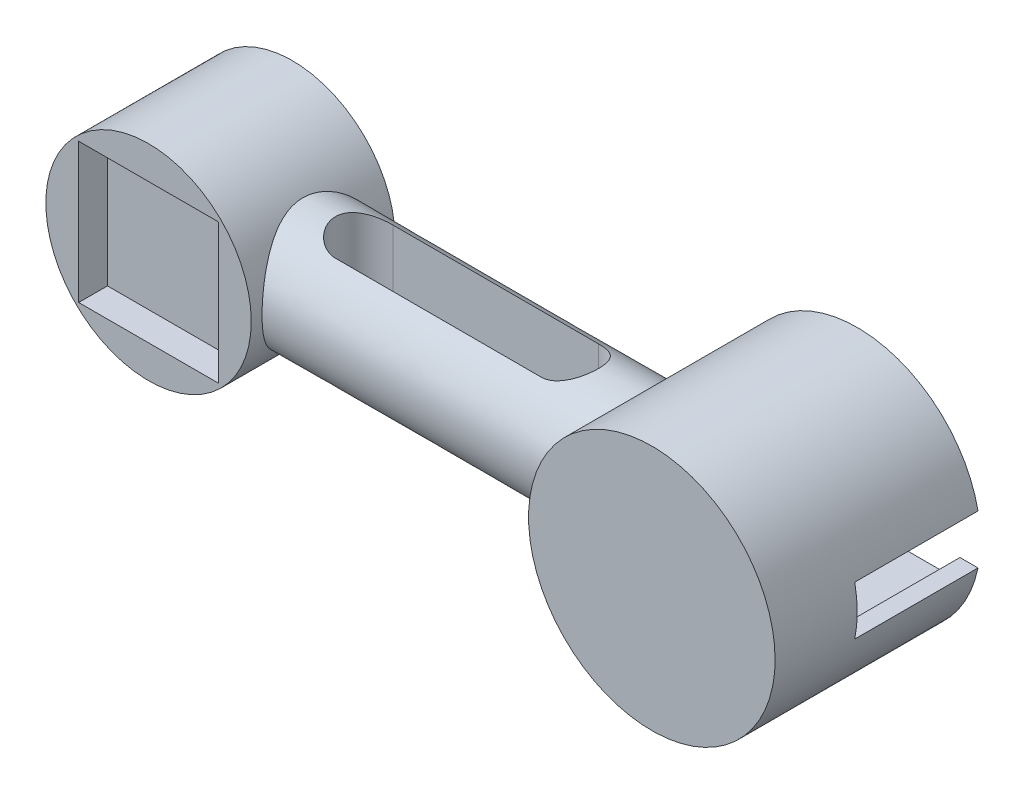
from build123d import *

# Parameters (mm, degrees)
SKETCH1_R               = 25
BOSS_EXTRUDE1_DEPTH     = 17.5
SKETCH4_R               = 30
BOSS_EXTRUDE2_DEPTH     = 25
CUT_EXTRUDE1_DEPTH      = 165.696691051
CUT_EXTRUDE1_DEPTH_BACK = 165.696691051
SKETCH6_W               = 34
SKETCH6_H               = 34
CUT_EXTRUDE2_DEPTH      = 7
SKETCH7_R               = 3.9
BOSS_EXTRUDE3_DEPTH     = 7
BOSS_EXTRUDE3_TAPER     = 2
CUT_EXTRUDE3_START      = -30
SKETCH8_W               = 42
SKETCH8_H               = 22
CUT_EXTRUDE3_DEPTH      = 30


with BuildPart() as part:
    # Sketch1 → Boss-Extrude1 (new, symmetric)
    with BuildSketch(Plane.XY):
        Circle(SKETCH1_R)
    extrude(amount=BOSS_EXTRUDE1_DEPTH, both=True)

    # Loft1: read off the stored shape, not the designer's step
    # Loft1: loft between two sections, ruled curve by curve
    loft1_from = [
        Edge.make_bspline([(0, 9.43003665, -11.665093603), (0, 32.760223857, 7.194979697), (0, 13.900150557, 30.525166904), (0, -9.43003665, 11.665093603), (0, -32.760223857, -7.194979697), (0, -13.900150557, -30.525166904), (0, 9.43003665, -11.665093603)], [0, 0, 0, 0, 0.5, 0.5, 0.5, 1, 1, 1, 1], 3, [1, 0.333333333, 0.333333333, 1, 0.333333333, 0.333333333, 1]),
    ]
    loft1_to = [
        Edge.make_bspline([(130, 5.054457016, -14.122764045), (130, 33.299985106, -4.013850014), (130, 23.191071075, 24.231678077), (130, -5.054457016, 14.122764045), (130, -33.299985106, 4.013850014), (130, -23.191071075, -24.231678077), (130, 5.054457016, -14.122764045)], [0, 0, 0, 0, 0.5, 0.5, 0.5, 1, 1, 1, 1], 3, [1, 0.333333333, 0.333333333, 1, 0.333333333, 0.333333333, 1]),
    ]
    loft1 = Solid(Shell([*[Face.make_surface_from_curves(loft1_from[k], loft1_to[k]) for k in range(1)], Face(Wire(loft1_from)), Face(Wire(loft1_to))]))
    add(loft1)

    # Sketch4 → Boss-Extrude2 (add, symmetric)
    with BuildSketch(Plane.XY):
        with Locations((130, 0)):
            Circle(SKETCH4_R)
    extrude(amount=BOSS_EXTRUDE2_DEPTH, both=True)

    # Sketch5 → Cut-Extrude1 (cut, two sides: drawn at the far end of the back side and taken through both)
    with BuildSketch(Plane(origin=(0, 0, 0), x_dir=(1, 0, 0), z_dir=(0, 1, 0)).offset(-CUT_EXTRUDE1_DEPTH_BACK)):
        with BuildLine():
            Line((35, 7), (85, 7))
            ThreePointArc((85, 7), (92, 0), (85, -7))
            Line((85, -7), (35, -7))
            ThreePointArc((35, -7), (28, 0), (35, 7))
        make_face()
    extrude(amount=CUT_EXTRUDE1_DEPTH + CUT_EXTRUDE1_DEPTH_BACK, mode=Mode.SUBTRACT)

    # Sketch6 → Cut-Extrude2 (cut)
    with BuildSketch(Plane.XY.offset(17.5)):
        Rectangle(SKETCH6_W, SKETCH6_H)
    extrude(amount=-CUT_EXTRUDE2_DEPTH, mode=Mode.SUBTRACT)

    # Sketch7 → Boss-Extrude3 (add)
    with BuildSketch(Plane(origin=(0, 0, -17.5), x_dir=(-1, 0, 0), z_dir=(0, 0, -1))):
        Circle(SKETCH7_R)
    extrude(amount=BOSS_EXTRUDE3_DEPTH, taper=BOSS_EXTRUDE3_TAPER)

    # Sketch8 → Cut-Extrude3 (cut)
    with BuildSketch(Plane(origin=(0, 0, -25), x_dir=(-1, 0, 0), z_dir=(0, 0, -1)).offset(CUT_EXTRUDE3_START)):
        with Locations((-134, 0)):
            Rectangle(SKETCH8_W, SKETCH8_H)
        with BuildLine():
            Line((-165, -6), (-159.393876913, -6))
            ThreePointArc((-159.393876913, -6), (-160, 0), (-159.393876913, 6))
            Line((-159.393876913, 6), (-165, 6))
            Line((-165, 6), (-165, -6))
        make_face()
        with BuildLine():
            Line((-159.393876913, -6), (-155, -6))
            Line((-155, -6), (-155, 6))
            Line((-155, 6), (-159.393876913, 6))
            ThreePointArc((-159.393876913, 6), (-160, 0), (-159.393876913, -6))
        make_face()
    extrude(amount=CUT_EXTRUDE3_DEPTH, mode=Mode.SUBTRACT)


solid = part.part
